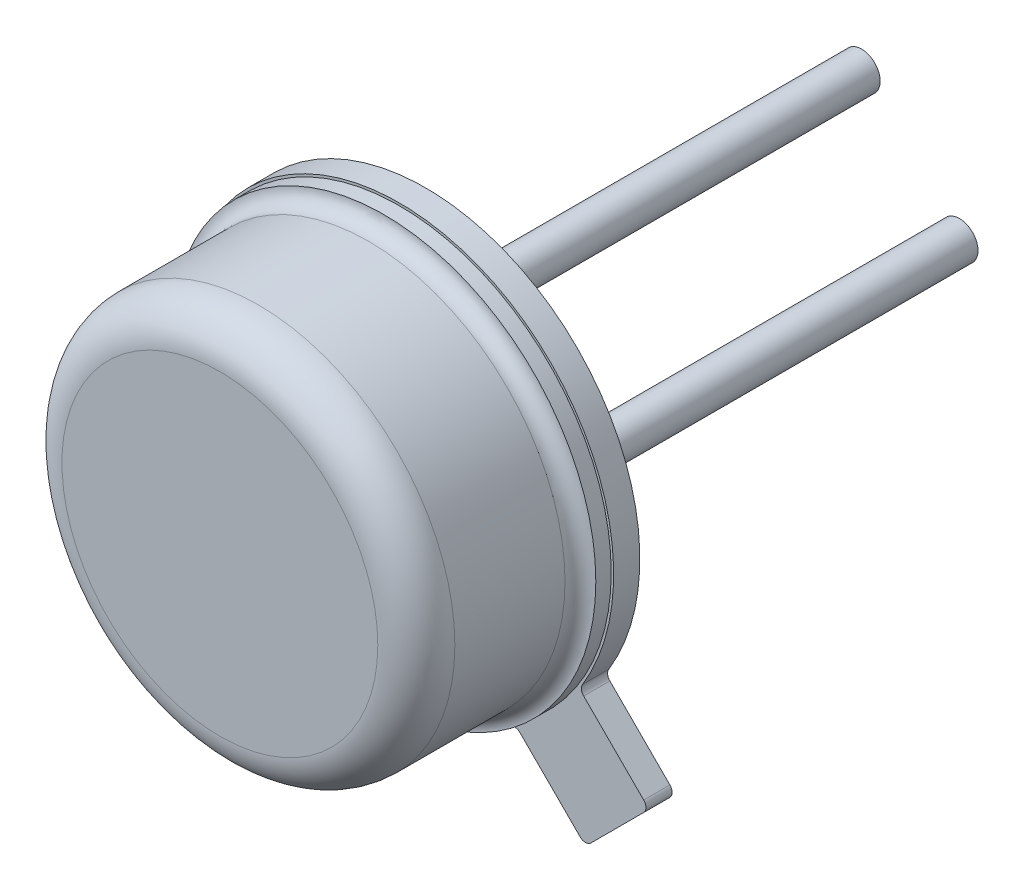
from build123d import *

# Parameters (mm, degrees)
SKETCH1_R           = 0.2415
BOSS_EXTRUDE1_DEPTH = 0.34
SKETCH2_R           = 2.75
BOSS_EXTRUDE2_DEPTH = 0.2
SKETCH3_R           = 2.55
BOSS_EXTRUDE3_DEPTH = 2.13
FILLET1_R           = 0.2
FILLET2_R           = 0.5
SKETCH4_R           = 0.241
BOSS_EXTRUDE4_DEPTH = 6


with BuildPart() as part:
    # Sketch1 → Boss-Extrude1 (new body)
    with BuildSketch(Plane.XY):
        with BuildLine():
            Line((99.541959491, 58.334320384), (100.320738424, 57.55554145))
            ThreePointArc((100.320738424, 57.55554145), (100.391449102, 57.526252128), (100.462159781, 57.55554145))
            Line((100.462159781, 57.55554145), (101.146639145, 58.240020814))
            ThreePointArc((101.146639145, 58.240020814), (101.175928467, 58.310731493), (101.146639145, 58.381442171))
            Line((101.146639145, 58.381442171), (100.367860211, 59.160221104))
            ThreePointArc((100.367860211, 59.160221104), (100.339288016, 59.218977235), (100.353096237, 59.282836347))
            ThreePointArc((100.353096237, 59.282836347), (96.008801273, 62.693379322), (99.419344248, 58.349084358))
            ThreePointArc((99.419344248, 58.349084358), (99.48320336, 58.362892578), (99.541959491, 58.334320384))
        make_face()
        with Locations((97.975618784, 61.99656181)):
            Circle(SKETCH1_R, mode=Mode.SUBTRACT)
        with Locations((99.245618784, 60.72656181)):
            Circle(SKETCH1_R, mode=Mode.SUBTRACT)
        with Locations((96.705618784, 60.72656181)):
            Circle(SKETCH1_R, mode=Mode.SUBTRACT)
    extrude(amount=BOSS_EXTRUDE1_DEPTH)

    # Sketch2 → Boss-Extrude2 (add)
    with BuildSketch(Plane.XY.offset(0.34)):
        with Locations((97.975618784, 60.72656181)):
            Circle(SKETCH2_R)
    extrude(amount=BOSS_EXTRUDE2_DEPTH)

    # Sketch3 → Boss-Extrude3 (add)
    with BuildSketch(Plane.XY.offset(0.54)):
        with Locations((97.975618784, 60.72656181)):
            Circle(SKETCH3_R)
    extrude(amount=BOSS_EXTRUDE3_DEPTH)

    # Fillet1
    fillet1_edges = [part.edges().sort_by_distance(p)[0] for p in [
        (95.425618784, 60.72656181, 0.54),
    ]]
    fillet(fillet1_edges, radius=FILLET1_R - 0.0001)  # a hair under: the kernel refuses the full size

    # Fillet2
    fillet2_edges = [part.edges().sort_by_distance(p)[0] for p in [
        (95.425618784, 60.72656181, 2.67),
    ]]
    fillet(fillet2_edges, radius=FILLET2_R)

    # Sketch4 → Boss-Extrude4 (add)
    with BuildSketch(Plane(origin=(0, 0, 0.34), x_dir=(-1, 0, 0), z_dir=(0, 0, -1))):
        with Locations(Location((-99.245618784, 60.72656181, 0), (0, 0, 180))):
            Circle(SKETCH4_R)
        with Locations(Location((-97.975618784, 61.99656181, 0), (0, 0, 180))):
            Circle(SKETCH4_R)
        with Locations(Location((-96.705618784, 60.72656181, 0), (0, 0, 180))):
            Circle(SKETCH4_R)
    extrude(amount=BOSS_EXTRUDE4_DEPTH)


solid = part.part
